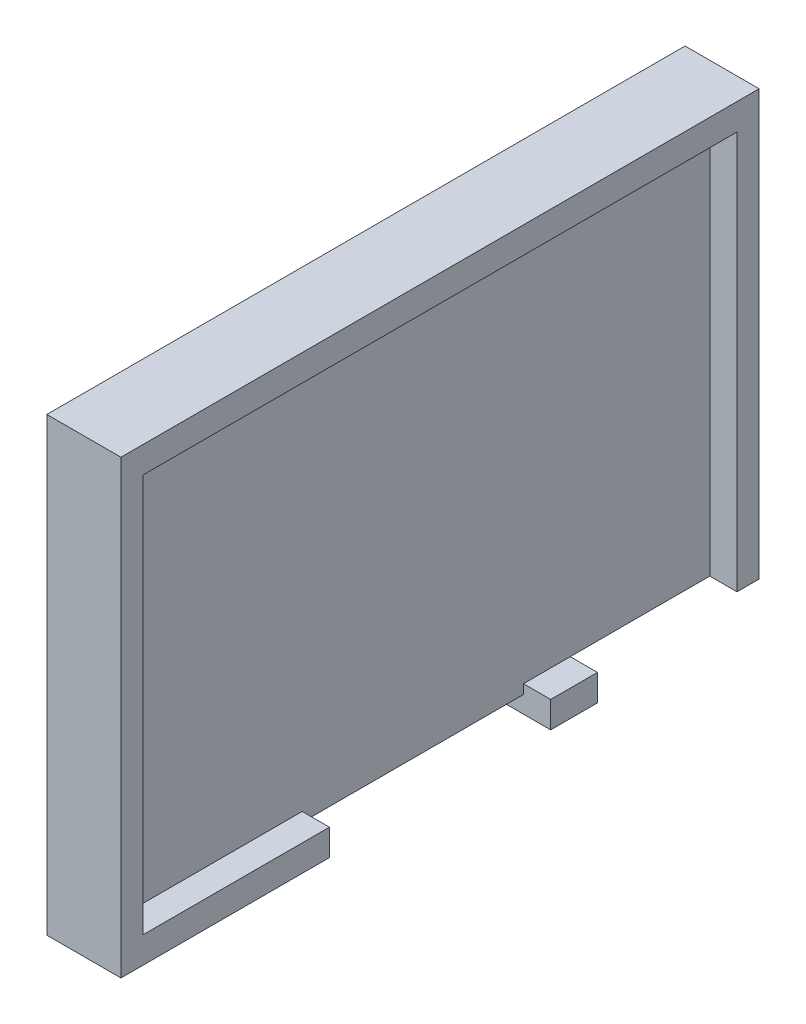
from build123d import *

# Parameters (mm, degrees)
SKETCH1_W           = 26.5
SKETCH1_H           = 37.5
BOSS_EXTRUDE1_DEPTH = 4.353
SKETCH2_W           = 23.4
SKETCH2_H           = 34.9
CUT_EXTRUDE1_DEPTH  = 1.6
SKETCH3_W           = 1.55
SKETCH3_H           = 13
CUT_EXTRUDE2_DEPTH  = 1.6
SKETCH4_W           = 2.753
SKETCH4_H           = 13
CUT_EXTRUDE3_DEPTH  = 1
SKETCH5_W           = 1.55
SKETCH5_H           = 9.5
CUT_EXTRUDE5_DEPTH  = 1.6
CUT_EXTRUDE6_DEPTH  = 9.5
SKETCH7_W           = 9.921470812
SKETCH7_H           = 17.49311959
CUT_EXTRUDE7_DEPTH  = 2
SKETCH10_W          = 1.6
SKETCH10_H          = 3.8
BOSS_EXTRUDE3_DEPTH = 1.6


with BuildPart() as part:
    # Sketch1 → Boss-Extrude1 (new body)
    with BuildSketch(Plane.YZ):
        with Locations((57.87, 107.93)):
            Rectangle(SKETCH1_W, SKETCH1_H)
    extrude(amount=BOSS_EXTRUDE1_DEPTH)

    # Sketch2 → Cut-Extrude1 (cut)
    with BuildSketch(Plane.YZ.offset(4.353)):
        with Locations((57.87, 107.93)):
            Rectangle(SKETCH2_W, SKETCH2_H)
    extrude(amount=-CUT_EXTRUDE1_DEPTH, mode=Mode.SUBTRACT)

    # Sketch3 → Cut-Extrude2 (cut)
    with BuildSketch(Plane.YZ.offset(4.353)):
        with Locations((45.395, 107.93)):
            Rectangle(SKETCH3_W, SKETCH3_H)
    extrude(amount=-CUT_EXTRUDE2_DEPTH, mode=Mode.SUBTRACT)

    # Sketch4 → Cut-Extrude3 (cut)
    with BuildSketch(Plane.XZ.offset(-44.62)):
        with Locations((1.3765, 107.93)):
            Rectangle(SKETCH4_W, SKETCH4_H)
    extrude(amount=-CUT_EXTRUDE3_DEPTH, mode=Mode.SUBTRACT)

    # Sketch5 → Cut-Extrude5 (cut)
    with BuildSketch(Plane.YZ.offset(4.353)):
        with Locations((45.395, 93.93)):
            Rectangle(SKETCH5_W, SKETCH5_H)
    extrude(amount=-CUT_EXTRUDE5_DEPTH, mode=Mode.SUBTRACT)

    # Sketch6 → Cut-Extrude6 (cut)
    with BuildSketch(Plane(origin=(0, 0, 89.18), x_dir=(1, 0, 0), z_dir=(0, 0, -1))):
        Polygon((1.953, -46.17), (2.753, -46.17), (2.753, -44.62), (0, -44.62), (0, -49.12), (1.953, -49.12), align=None)
    extrude(amount=-CUT_EXTRUDE6_DEPTH, mode=Mode.SUBTRACT)

    # Sketch7 → Cut-Extrude7 (cut)
    with BuildSketch(Plane(origin=(0, 0, 0), x_dir=(0, -1, 0), z_dir=(-1, 0, 0))):
        with Locations((-61.879572923, 107.531107948)):
            Rectangle(SKETCH7_W, SKETCH7_H)
        Polygon((-57.329123903, 95.837945919), (-57.329123903, 90.653417938), (-49.12, 90.653417938), (-49.12, 95.837945919), (-50.242359038, 95.837945919), (-50.242359038, 122.506561072), (-54.830106819, 122.506561072), (-54.830106819, 95.837945919), align=None)
    extrude(amount=-CUT_EXTRUDE7_DEPTH, mode=Mode.SUBTRACT)

    # Sketch10 → Boss-Extrude3 (add)
    with BuildSketch(Plane(origin=(0, 0, 0), x_dir=(0, -1, 0), z_dir=(-1, 0, 0))):
        with Locations((-68.22, 123.18)):
            Rectangle(SKETCH10_W, SKETCH10_H)
    boss_extrude3 = extrude(amount=BOSS_EXTRUDE3_DEPTH)

    # Mirror1: Boss-Extrude3 across plane
    add(boss_extrude3.mirror(Plane(origin=(0, 57.62, 0), x_dir=(0, 0, 1), z_dir=(0, -1, 0))))

    # Mirror2: Boss-Extrude3 across plane
    add(boss_extrude3.mirror(Plane.XY.offset(107.93)))


solid = part.part
